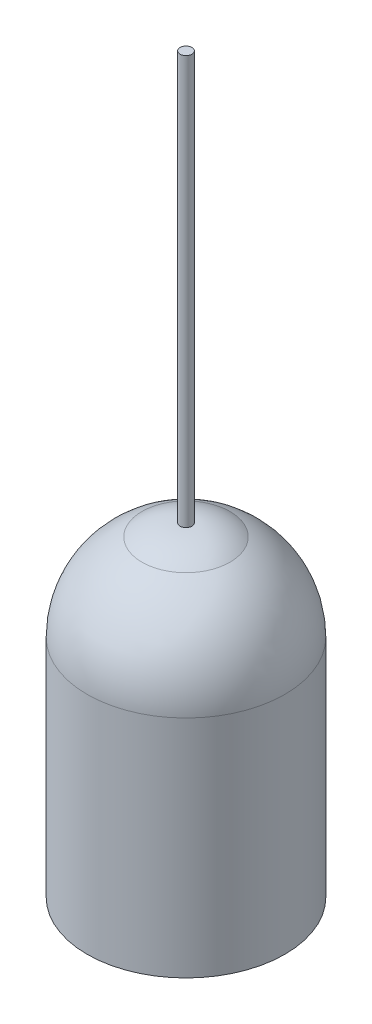
from build123d import *

# Parameters (mm, degrees)
SKETCH2_R           = 7.993329912
BOSS_EXTRUDE1_DEPTH = 552.704
SKETCH5_R           = 7.993329912
BOSS_EXTRUDE2_DEPTH = 89.154
SKETCH6_R           = 21.547103365
SKETCH6_R_2         = 19.007103365
BOSS_EXTRUDE3_DEPTH = 60.706
SKETCH10_R          = 1.589163983
SKETCH10_R_2        = 1.54985095
SKETCH10_R_3        = 1.539601187
BOSS_EXTRUDE5_DEPTH = 28.194


# Read off the part's stored shape, not the designer's step: Shell1
with BuildPart() as part:
    # Sketch1 → Revolve1 (revolve)
    with BuildSketch(Plane.XY, mode=Mode.PRIVATE) as revolve1_sk:
        with BuildLine():
            Line((-133.88411215, 98.63271028), (-133.88411215, -206.16728972))
            Line((-133.88411215, -206.16728972), (0, -206.16728972))
            Line((0, -206.16728972), (0, 232.51682243))
            ThreePointArc((0, 232.51682243), (-31.275766946, 229.999091835), (-59.607959647, 216.515790231))
            ThreePointArc((-59.607959647, 216.515790231), (-113.766628882, 168.298640564), (-133.88411215, 98.63271028))
        make_face()
    revolve(revolve1_sk.sketch.rotate(Axis((0, 159.877570093, 0), (0, -1, 0)), 270), axis=Axis((0, 159.877570093, 0), (0, -1, 0)))

    # Shell1 outline → Shell1 (revolve, cut)
    with BuildSketch(Plane.XY):
        with BuildLine():
            Line((0, 226.131283606), (0, -206.16728972))
            Line((0, -206.16728972), (127.53411215, -206.16728972))
            Line((127.53411215, -206.16728972), (127.53411215, 98.63271028))
            ThreePointArc((127.53411215, 98.63271028), (108.240247354, 165.157161629), (56.346621929, 211.035342568))
            add(Edge.make_bspline(
                [(56.346621929, 211.035342568), (48.349257744, 216.905484801), (39.197707024, 221.722036733), (29.21533776, 225.027016018), (18.890531691, 226.613981261), (7.017697058, 226.613981261), (5.247064647, 226.564858831), (3.485574628, 226.467328934), (1.735761789, 226.32239205), (0, 226.131283606)],
                knots=[0.937607853, 0.937607853, 0.937607853, 0.937607853, 0.937607853, 0.937607853, 1.569267725, 1.569267725, 1.569267725, 1.569267725, 1.680455267, 1.680455267, 1.680455267, 1.680455267, 1.680455267, 1.680455267], degree=5, weights=[1, 1, 0.999036778, 0.999002178, 1, 1, 0.999999308, 0.99999934, 1, 1]))
        make_face()
    revolve(axis=Axis((0, 0, 0), (0, 1, 0)), mode=Mode.SUBTRACT)


with BuildPart() as body_2:
    # Sketch2 → Boss-Extrude1 (new body)
    with BuildSketch(Plane(origin=(0, 233.68, 0), x_dir=(1, 0, 0), z_dir=(0, 1, 0))):
        with Locations(Location((0, 0, 0), (0, 0, 270))):
            Circle(SKETCH2_R)
    extrude(amount=BOSS_EXTRUDE1_DEPTH)



with BuildPart() as body_3:
    # Sketch3 → Revolve3 (revolve)
    with BuildSketch(Plane(origin=(0, 0, 0), x_dir=(0, 0, -1), z_dir=(1, 0, 0))):
        with BuildLine():
            Line((-70.417248326, -79.787561442), (-70.417248326, 69.62704314))
            ThreePointArc((-70.417248326, 69.62704314), (-69.794611796, 73.938688439), (-67.977578354, 77.89802562))
            Line((-67.977578354, 77.89802562), (-31.867864063, 133.78210726))
            Line((-31.867864063, 133.78210726), (0, 133.78210726))
            Line((0, 133.78210726), (0, 135.521793334))
            Line((0, 135.521793334), (-33.767868744, 135.521793334))
            Line((-33.767868744, 135.521793334), (-70.110966692, 79.276522699))
            ThreePointArc((-70.110966692, 79.276522699), (-72.230839041, 74.657295989), (-72.957248326, 69.62704314))
            Line((-72.957248326, 69.62704314), (-72.957248326, -79.787561442))
            Line((-72.957248326, -79.787561442), (-70.417248326, -79.787561442))
        make_face()
        with BuildLine():
            ThreePointArc((-35.353656266, 141.510232001), (-39.424155926, 137.050945424), (-35.987425637, 132.086764809))
            Line((-35.987425637, 132.086764809), (-33.767868744, 135.521793334))
            Line((-33.767868744, 135.521793334), (0, 135.521793334))
            Line((0, 135.521793334), (0, 141.510232001))
            Line((0, 141.510232001), (-28.806589161, 141.510232001))
            Line((-28.806589161, 141.510232001), (-35.353656266, 141.510232001))
        make_face()
        with BuildLine():
            ThreePointArc((0, 151.086676254), (-15.128880017, 148.481063978), (-28.806589161, 141.510232001))
            Line((-28.806589161, 141.510232001), (0, 141.510232001))
            Line((0, 141.510232001), (0, 151.086676254))
        make_face()
    revolve(axis=Axis((0, 161.821544937, 0), (0, -1, 0)))


with BuildPart() as body_2_1:
    add(body_2.part)

    add(body_3.part)  # Boss-Extrude2 merges body 3
    # Sketch5 → Boss-Extrude2 (add)
    with BuildSketch(Plane.XZ.offset(-233.68)):
        with Locations(Location((0, 0, 0), (0, 0, 270))):
            Circle(SKETCH5_R)
    extrude(amount=BOSS_EXTRUDE2_DEPTH)

    # Sketch6 → Boss-Extrude3 (add)
    with BuildSketch(Plane.XZ.offset(-133.78210726)):
        with Locations(Location((0, 0, 0), (0, 0, 90))):
            Circle(SKETCH6_R)
        with Locations(Location((0, 0, 0), (0, 0, 90))):
            Circle(SKETCH6_R_2, mode=Mode.SUBTRACT)
    extrude(amount=BOSS_EXTRUDE3_DEPTH)


with BuildPart() as body_3_2:
    # Sketch8 → Revolve4 (revolve)
    with BuildSketch(Plane(origin=(0, 0, 0), x_dir=(0, 0, -1), z_dir=(1, 0, 0)), mode=Mode.PRIVATE) as revolve4_sk:
        with BuildLine():
            Line((0, 73.07610726), (0, 24.192456121))
            ThreePointArc((0, 24.192456121), (-4.153496651, 25.315350132), (-6.296456329, 29.046321749))
            ThreePointArc((-6.296456329, 29.046321749), (-21.320373859, 39.107730007), (-24.829397817, 56.845733981))
            ThreePointArc((-24.829397817, 56.845733981), (-21.585137769, 65.316735398), (-16.886708608, 73.07610726))
            Line((-16.886708608, 73.07610726), (0, 73.07610726))
        make_face()
    revolve(revolve4_sk.sketch.rotate(Axis((0, 0, 0), (0, 1, 0)), 180), axis=Axis((0, 0, 0), (0, 1, 0)))

    # Sketch10 → Boss-Extrude5 (add)
    with BuildSketch(Plane.XZ.offset(-73.07610726)):
        with Locations((-5.819290639, 7.613149526)):
            Circle(SKETCH10_R)
        with Locations((5.13191713, 9.202313509)):
            Circle(SKETCH10_R)
        with Locations((7.349883261, -4.585664192)):
            Circle(SKETCH10_R_2)
        with Locations((-4.241625311, -6.775096885)):
            Circle(SKETCH10_R_3)
    extrude(amount=BOSS_EXTRUDE5_DEPTH)


solid = Compound([part.part, body_2_1.part, body_3_2.part])
